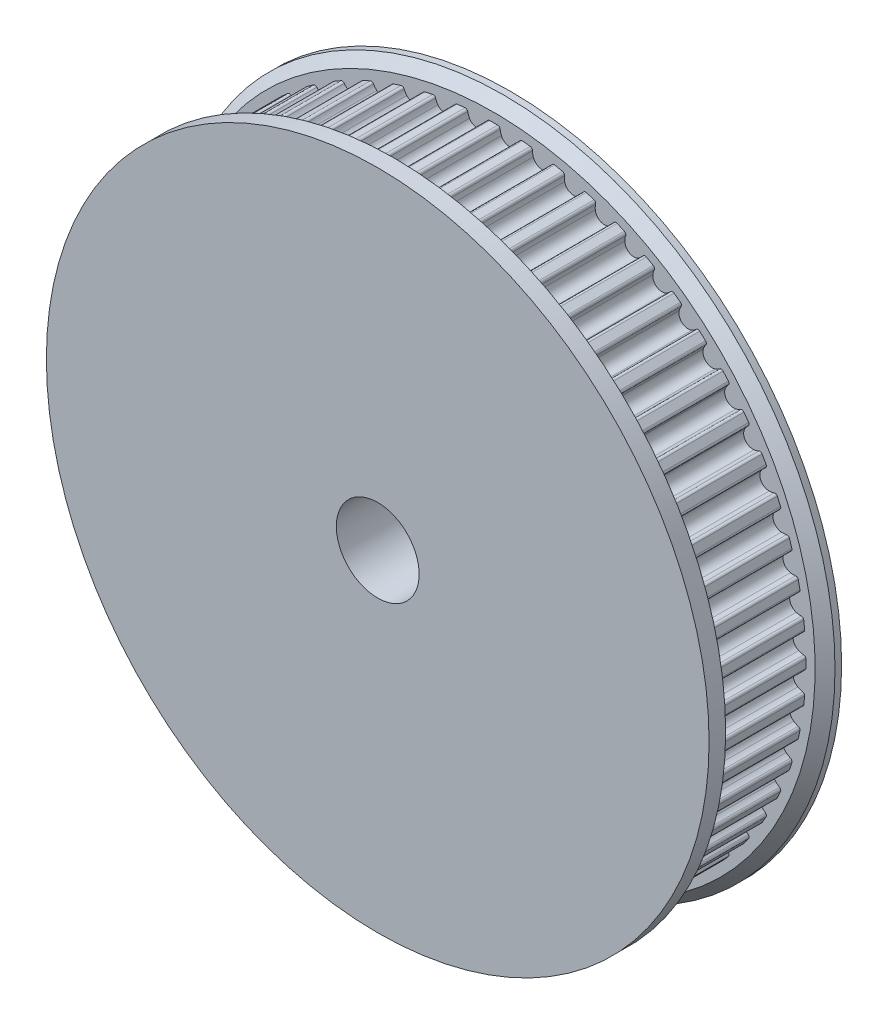
from build123d import *

# Parameters (mm, degrees)
BOSS_EXTRUDE1_DEPTH = 3
SKETCH2_R           = 20
BOSS_EXTRUDE2_DEPTH = 1
BOSS_EXTRUDE3_START = 1
SKETCH3_R           = 20
BOSS_EXTRUDE3_DEPTH = 1
SKETCH7_R           = 10
SKETCH7_R_2         = 6.6
BOSS_EXTRUDE4_DEPTH = 7
SKETCH8_R           = 1.75
CUT_EXTRUDE4_DEPTH  = 31.347981811
CIRPATTERN2_COUNT   = 2
CIRPATTERN2_ANGLE   = 90
SKETCH9_R           = 2.5
CUT_EXTRUDE5_DEPTH  = 30.393876913
FILLET1_R           = 2
FILLET2_R           = 0.8
CHAMFER1_SIZE       = 0.6


with BuildPart() as part:
    # Sketch1 → Boss-Extrude1 (new, symmetric)
    with BuildSketch(Plane.XY):
        with BuildLine():
            Line((0, 18.844593171), (0.2403451, 18.844593171))
            ThreePointArc((0.2403451, 18.844593171), (0.341538212, 18.805317848), (0.389739428, 18.708059226))
            ThreePointArc((0.389739428, 18.708059226), (0.415701801, 18.55472728), (0.465123358, 18.407274778))
            ThreePointArc((0.465123358, 18.407274778), (0.946997836, 18.06979516), (1.461508782, 18.355056431))
            ThreePointArc((1.461508782, 18.355056431), (1.526072586, 18.496535213), (1.567920287, 18.646313384))
            ThreePointArc((1.567920287, 18.646313384), (1.626023746, 18.738000814), (1.730767901, 18.766483422))
            Line((1.730767901, 18.766483422), (1.969796365, 18.741360518))
            Line((1.969796365, 18.741360518), (2.208824829, 18.716237614))
            ThreePointArc((2.208824829, 18.716237614), (2.305358205, 18.666599885), (2.343129077, 18.564835657))
            ThreePointArc((2.343129077, 18.564835657), (2.352921672, 18.409629872), (2.386659509, 18.257819171))
            ThreePointArc((2.386659509, 18.257819171), (2.830618003, 17.871818703), (3.372128326, 18.101736244))
            ThreePointArc((3.372128326, 18.101736244), (3.451127002, 18.235691236), (3.508401539, 18.38027463))
            ThreePointArc((3.508401539, 18.38027463), (3.575770648, 18.465386321), (3.682918246, 18.482764153))
            Line((3.682918246, 18.482764153), (3.918011229, 18.432793597))
            Line((3.918011229, 18.432793597), (4.153104212, 18.382823041))
            ThreePointArc((4.153104212, 18.382823041), (4.243920212, 18.323366747), (4.270846912, 18.218211863))
            ThreePointArc((4.270846912, 18.218211863), (4.264362441, 18.062832707), (4.282046919, 17.908327077))
            ThreePointArc((4.282046919, 17.908327077), (4.683225326, 17.47803486), (5.245802126, 17.650089647))
            ThreePointArc((5.245802126, 17.650089647), (5.338370149, 17.775053209), (5.41044401, 17.912857741))
            ThreePointArc((5.41044401, 17.912857741), (5.486340658, 17.990461192), (5.594717769, 17.996543853))
            Line((5.594717769, 17.996543853), (5.823299542, 17.922273132))
            Line((5.823299542, 17.922273132), (6.051881315, 17.848002412))
            ThreePointArc((6.051881315, 17.848002412), (6.135984941, 17.779378969), (6.151772456, 17.671985528))
            ThreePointArc((6.151772456, 17.671985528), (6.129081962, 17.518135367), (6.130519327, 17.362627603))
            ThreePointArc((6.130519327, 17.362627603), (6.484522253, 16.89275801), (7.06200182, 17.005064975))
            ThreePointArc((7.06200182, 17.005064975), (7.167124995, 17.11966798), (7.253208524, 17.249183834))
            ThreePointArc((7.253208524, 17.249183834), (7.336801172, 17.318428805), (7.445220392, 17.313149652))
            Line((7.445220392, 17.313149652), (7.664786567, 17.215392493))
            Line((7.664786567, 17.215392493), (7.884352741, 17.117635333))
            ThreePointArc((7.884352741, 17.117635333), (7.960822535, 17.040596594), (7.965297893, 16.932141221))
            ThreePointArc((7.965297893, 16.932141221), (7.926649979, 16.781505669), (7.911824483, 16.626699548))
            ThreePointArc((7.911824483, 16.626699548), (8.214773396, 16.122400568), (8.800828745, 16.173729252))
            ThreePointArc((8.800828745, 16.173729252), (8.91735532, 16.276716085), (9.016505367, 16.39652426))
            ThreePointArc((9.016505367, 16.39652426), (9.106878157, 16.456652089), (9.214151623, 16.44006896))
            Line((9.214151623, 16.44006896), (9.422296586, 16.31989641))
            Line((9.422296586, 16.31989641), (9.630441548, 16.19972386))
            ThreePointArc((9.630441548, 16.19972386), (9.698439692, 16.115113877), (9.691553859, 16.006784831))
            ThreePointArc((9.691553859, 16.006784831), (9.63737196, 15.861014284), (9.606446033, 15.708605893))
            ThreePointArc((9.606446033, 15.708605893), (9.855021764, 15.175402731), (10.443231948, 15.165190766))
            ThreePointArc((10.443231948, 15.165190766), (10.569885234, 15.255433084), (10.681015491, 15.364220934))
            ThreePointArc((10.681015491, 15.364220934), (10.777178278, 15.414572848), (10.882130681, 15.386867433))
            Line((10.882130681, 15.386867433), (11.076573951, 15.245596127))
            Line((11.076573951, 15.245596127), (11.271017222, 15.104324822))
            ThreePointArc((11.271017222, 15.104324822), (11.329798713, 15.0130706), (11.311627133, 14.906054758))
            ThreePointArc((11.311627133, 14.906054758), (11.242504877, 14.766746308), (11.195817351, 14.618405465))
            ThreePointArc((11.195817351, 14.618405465), (11.38729645, 14.062140007), (11.971216917, 13.990499277))
            ThreePointArc((11.971216917, 13.990499277), (12.106609273, 14.067008365), (12.228502175, 14.163583989))
            ThreePointArc((12.228502175, 14.163583989), (12.32940138, 14.203608321), (12.430882838, 14.165084166))
            Line((12.430882838, 14.165084166), (12.609494055, 14.004261903))
            Line((12.609494055, 14.004261903), (12.788105272, 13.843439641))
            ThreePointArc((12.788105272, 13.843439641), (12.837026089, 13.74654098), (12.807767853, 13.642010829))
            ThreePointArc((12.807767853, 13.642010829), (12.724462558, 13.510690768), (12.662524951, 13.368042728))
            ThreePointArc((12.662524951, 13.368042728), (12.794809534, 12.794809534), (13.368042728, 12.662524951))
            ThreePointArc((13.368042728, 12.662524951), (13.510690768, 12.724462558), (13.642010829, 12.807767853))
            ThreePointArc((13.642010829, 12.807767853), (13.74654098, 12.837026089), (13.843439641, 12.788105272))
            Line((13.843439641, 12.788105272), (14.004261903, 12.609494055))
            Line((14.004261903, 12.609494055), (14.165084166, 12.430882838))
            ThreePointArc((14.165084166, 12.430882838), (14.203608321, 12.32940138), (14.163583989, 12.228502175))
            ThreePointArc((14.163583989, 12.228502175), (14.067008365, 12.106609273), (13.990499277, 11.971216917))
            ThreePointArc((13.990499277, 11.971216917), (14.062140007, 11.38729645), (14.618405465, 11.195817351))
            ThreePointArc((14.618405465, 11.195817351), (14.766746308, 11.242504877), (14.906054758, 11.311627133))
            ThreePointArc((14.906054758, 11.311627133), (15.0130706, 11.329798713), (15.104324822, 11.271017222))
            Line((15.104324822, 11.271017222), (15.245596127, 11.076573951))
            Line((15.245596127, 11.076573951), (15.386867433, 10.882130681))
            ThreePointArc((15.386867433, 10.882130681), (15.414572848, 10.777178278), (15.364220934, 10.681015491))
            ThreePointArc((15.364220934, 10.681015491), (15.255433084, 10.569885234), (15.165190766, 10.443231948))
            ThreePointArc((15.165190766, 10.443231948), (15.175402731, 9.855021764), (15.708605893, 9.606446033))
            ThreePointArc((15.708605893, 9.606446033), (15.861014284, 9.63737196), (16.006784831, 9.691553859))
            ThreePointArc((16.006784831, 9.691553859), (16.115113877, 9.698439692), (16.19972386, 9.630441548))
            Line((16.19972386, 9.630441548), (16.31989641, 9.422296586))
            Line((16.31989641, 9.422296586), (16.44006896, 9.214151623))
            ThreePointArc((16.44006896, 9.214151623), (16.456652089, 9.106878157), (16.39652426, 9.016505367))
            ThreePointArc((16.39652426, 9.016505367), (16.276716085, 8.91735532), (16.173729252, 8.800828745))
            ThreePointArc((16.173729252, 8.800828745), (16.122400568, 8.214773396), (16.626699548, 7.911824483))
            ThreePointArc((16.626699548, 7.911824483), (16.781505669, 7.926649979), (16.932141221, 7.965297893))
            ThreePointArc((16.932141221, 7.965297893), (17.040596594, 7.960822535), (17.117635333, 7.884352741))
            Line((17.117635333, 7.884352741), (17.215392493, 7.664786567))
            Line((17.215392493, 7.664786567), (17.313149652, 7.445220392))
            ThreePointArc((17.313149652, 7.445220392), (17.318428805, 7.336801172), (17.249183834, 7.253208524))
            ThreePointArc((17.249183834, 7.253208524), (17.11966798, 7.167124995), (17.005064975, 7.06200182))
            ThreePointArc((17.005064975, 7.06200182), (16.89275801, 6.484522253), (17.362627603, 6.130519327))
            ThreePointArc((17.362627603, 6.130519327), (17.518135367, 6.129081962), (17.671985528, 6.151772456))
            ThreePointArc((17.671985528, 6.151772456), (17.779378969, 6.135984941), (17.848002412, 6.051881315))
            Line((17.848002412, 6.051881315), (17.922273132, 5.823299542))
            Line((17.922273132, 5.823299542), (17.996543853, 5.594717769))
            ThreePointArc((17.996543853, 5.594717769), (17.990461192, 5.486340658), (17.912857741, 5.41044401))
            ThreePointArc((17.912857741, 5.41044401), (17.775053209, 5.338370149), (17.650089647, 5.245802126))
            ThreePointArc((17.650089647, 5.245802126), (17.47803486, 4.683225326), (17.908327077, 4.282046919))
            ThreePointArc((17.908327077, 4.282046919), (18.062832707, 4.264362441), (18.218211863, 4.270846912))
            ThreePointArc((18.218211863, 4.270846912), (18.323366747, 4.243920212), (18.382823041, 4.153104212))
            Line((18.382823041, 4.153104212), (18.432793597, 3.918011229))
            Line((18.432793597, 3.918011229), (18.482764153, 3.682918246))
            ThreePointArc((18.482764153, 3.682918246), (18.465386321, 3.575770648), (18.38027463, 3.508401539))
            ThreePointArc((18.38027463, 3.508401539), (18.235691236, 3.451127002), (18.101736244, 3.372128326))
            ThreePointArc((18.101736244, 3.372128326), (17.871818703, 2.830618003), (18.257819171, 2.386659509))
            ThreePointArc((18.257819171, 2.386659509), (18.409629872, 2.352921672), (18.564835657, 2.343129077))
            ThreePointArc((18.564835657, 2.343129077), (18.666599885, 2.305358205), (18.716237614, 2.208824829))
            Line((18.716237614, 2.208824829), (18.741360518, 1.969796365))
            Line((18.741360518, 1.969796365), (18.766483422, 1.730767901))
            ThreePointArc((18.766483422, 1.730767901), (18.738000814, 1.626023746), (18.646313384, 1.567920287))
            ThreePointArc((18.646313384, 1.567920287), (18.496535213, 1.526072586), (18.355056431, 1.461508782))
            ThreePointArc((18.355056431, 1.461508782), (18.06979516, 0.946997836), (18.407274778, 0.465123358))
            ThreePointArc((18.407274778, 0.465123358), (18.55472728, 0.415701801), (18.708059226, 0.389739428))
            ThreePointArc((18.708059226, 0.389739428), (18.805317848, 0.341538212), (18.844593171, 0.2403451))
            Line((18.844593171, 0.2403451), (18.844593171, 0))
            Line((18.844593171, 0), (18.844593171, -0.2403451))
            ThreePointArc((18.844593171, -0.2403451), (18.805317848, -0.341538212), (18.708059226, -0.389739428))
            ThreePointArc((18.708059226, -0.389739428), (18.55472728, -0.415701801), (18.407274778, -0.465123358))
            ThreePointArc((18.407274778, -0.465123358), (18.06979516, -0.946997836), (18.355056431, -1.461508782))
            ThreePointArc((18.355056431, -1.461508782), (18.496535213, -1.526072586), (18.646313384, -1.567920287))
            ThreePointArc((18.646313384, -1.567920287), (18.738000814, -1.626023746), (18.766483422, -1.730767901))
            Line((18.766483422, -1.730767901), (18.741360518, -1.969796365))
            Line((18.741360518, -1.969796365), (18.716237614, -2.208824829))
            ThreePointArc((18.716237614, -2.208824829), (18.666599885, -2.305358205), (18.564835657, -2.343129077))
            ThreePointArc((18.564835657, -2.343129077), (18.409629872, -2.352921672), (18.257819171, -2.386659509))
            ThreePointArc((18.257819171, -2.386659509), (17.871818703, -2.830618003), (18.101736244, -3.372128326))
            ThreePointArc((18.101736244, -3.372128326), (18.235691236, -3.451127002), (18.38027463, -3.508401539))
            ThreePointArc((18.38027463, -3.508401539), (18.465386321, -3.575770648), (18.482764153, -3.682918246))
            Line((18.482764153, -3.682918246), (18.432793597, -3.918011229))
            Line((18.432793597, -3.918011229), (18.382823041, -4.153104212))
            ThreePointArc((18.382823041, -4.153104212), (18.323366747, -4.243920212), (18.218211863, -4.270846912))
            ThreePointArc((18.218211863, -4.270846912), (18.062832707, -4.264362441), (17.908327077, -4.282046919))
            ThreePointArc((17.908327077, -4.282046919), (17.47803486, -4.683225326), (17.650089647, -5.245802126))
            ThreePointArc((17.650089647, -5.245802126), (17.775053209, -5.338370149), (17.912857741, -5.41044401))
            ThreePointArc((17.912857741, -5.41044401), (17.990461192, -5.486340658), (17.996543853, -5.594717769))
            Line((17.996543853, -5.594717769), (17.922273132, -5.823299542))
            Line((17.922273132, -5.823299542), (17.848002412, -6.051881315))
            ThreePointArc((17.848002412, -6.051881315), (17.779378969, -6.135984941), (17.671985528, -6.151772456))
            ThreePointArc((17.671985528, -6.151772456), (17.518135367, -6.129081962), (17.362627603, -6.130519327))
            ThreePointArc((17.362627603, -6.130519327), (16.89275801, -6.484522253), (17.005064975, -7.06200182))
            ThreePointArc((17.005064975, -7.06200182), (17.11966798, -7.167124995), (17.249183834, -7.253208524))
            ThreePointArc((17.249183834, -7.253208524), (17.318428805, -7.336801172), (17.313149652, -7.445220392))
            Line((17.313149652, -7.445220392), (17.215392493, -7.664786567))
            Line((17.215392493, -7.664786567), (17.117635333, -7.884352741))
            ThreePointArc((17.117635333, -7.884352741), (17.040596594, -7.960822535), (16.932141221, -7.965297893))
            ThreePointArc((16.932141221, -7.965297893), (16.781505669, -7.926649979), (16.626699548, -7.911824483))
            ThreePointArc((16.626699548, -7.911824483), (16.122400568, -8.214773396), (16.173729252, -8.800828745))
            ThreePointArc((16.173729252, -8.800828745), (16.276716085, -8.91735532), (16.39652426, -9.016505367))
            ThreePointArc((16.39652426, -9.016505367), (16.456652089, -9.106878157), (16.44006896, -9.214151623))
            Line((16.44006896, -9.214151623), (16.31989641, -9.422296586))
            Line((16.31989641, -9.422296586), (16.19972386, -9.630441548))
            ThreePointArc((16.19972386, -9.630441548), (16.115113877, -9.698439692), (16.006784831, -9.691553859))
            ThreePointArc((16.006784831, -9.691553859), (15.861014284, -9.63737196), (15.708605893, -9.606446033))
            ThreePointArc((15.708605893, -9.606446033), (15.175402731, -9.855021764), (15.165190766, -10.443231948))
            ThreePointArc((15.165190766, -10.443231948), (15.255433084, -10.569885234), (15.364220934, -10.681015491))
            ThreePointArc((15.364220934, -10.681015491), (15.414572848, -10.777178278), (15.386867433, -10.882130681))
            Line((15.386867433, -10.882130681), (15.245596127, -11.076573951))
            Line((15.245596127, -11.076573951), (15.104324822, -11.271017222))
            ThreePointArc((15.104324822, -11.271017222), (15.0130706, -11.329798713), (14.906054758, -11.311627133))
            ThreePointArc((14.906054758, -11.311627133), (14.766746308, -11.242504877), (14.618405465, -11.195817351))
            ThreePointArc((14.618405465, -11.195817351), (14.062140007, -11.38729645), (13.990499277, -11.971216917))
            ThreePointArc((13.990499277, -11.971216917), (14.067008365, -12.106609273), (14.163583989, -12.228502175))
            ThreePointArc((14.163583989, -12.228502175), (14.203608321, -12.32940138), (14.165084166, -12.430882838))
            Line((14.165084166, -12.430882838), (14.004261903, -12.609494055))
            Line((14.004261903, -12.609494055), (13.843439641, -12.788105272))
            ThreePointArc((13.843439641, -12.788105272), (13.74654098, -12.837026089), (13.642010829, -12.807767853))
            ThreePointArc((13.642010829, -12.807767853), (13.510690768, -12.724462558), (13.368042728, -12.662524951))
            ThreePointArc((13.368042728, -12.662524951), (12.794809534, -12.794809534), (12.662524951, -13.368042728))
            ThreePointArc((12.662524951, -13.368042728), (12.724462558, -13.510690768), (12.807767853, -13.642010829))
            ThreePointArc((12.807767853, -13.642010829), (12.837026089, -13.74654098), (12.788105272, -13.843439641))
            Line((12.788105272, -13.843439641), (12.609494055, -14.004261903))
            Line((12.609494055, -14.004261903), (12.430882838, -14.165084166))
            ThreePointArc((12.430882838, -14.165084166), (12.32940138, -14.203608321), (12.228502175, -14.163583989))
            ThreePointArc((12.228502175, -14.163583989), (12.106609273, -14.067008365), (11.971216917, -13.990499277))
            ThreePointArc((11.971216917, -13.990499277), (11.38729645, -14.062140007), (11.195817351, -14.618405465))
            ThreePointArc((11.195817351, -14.618405465), (11.242504877, -14.766746308), (11.311627133, -14.906054758))
            ThreePointArc((11.311627133, -14.906054758), (11.329798713, -15.0130706), (11.271017222, -15.104324822))
            Line((11.271017222, -15.104324822), (11.076573951, -15.245596127))
            Line((11.076573951, -15.245596127), (10.882130681, -15.386867433))
            ThreePointArc((10.882130681, -15.386867433), (10.777178278, -15.414572848), (10.681015491, -15.364220934))
            ThreePointArc((10.681015491, -15.364220934), (10.569885234, -15.255433084), (10.443231948, -15.165190766))
            ThreePointArc((10.443231948, -15.165190766), (9.855021764, -15.175402731), (9.606446033, -15.708605893))
            ThreePointArc((9.606446033, -15.708605893), (9.63737196, -15.861014284), (9.691553859, -16.006784831))
            ThreePointArc((9.691553859, -16.006784831), (9.698439692, -16.115113877), (9.630441548, -16.19972386))
            Line((9.630441548, -16.19972386), (9.422296586, -16.31989641))
            Line((9.422296586, -16.31989641), (9.214151623, -16.44006896))
            ThreePointArc((9.214151623, -16.44006896), (9.106878157, -16.456652089), (9.016505367, -16.39652426))
            ThreePointArc((9.016505367, -16.39652426), (8.91735532, -16.276716085), (8.800828745, -16.173729252))
            ThreePointArc((8.800828745, -16.173729252), (8.214773396, -16.122400568), (7.911824483, -16.626699548))
            ThreePointArc((7.911824483, -16.626699548), (7.926649979, -16.781505669), (7.965297893, -16.932141221))
            ThreePointArc((7.965297893, -16.932141221), (7.960822535, -17.040596594), (7.884352741, -17.117635333))
            Line((7.884352741, -17.117635333), (7.664786567, -17.215392493))
            Line((7.664786567, -17.215392493), (7.445220392, -17.313149652))
            ThreePointArc((7.445220392, -17.313149652), (7.336801172, -17.318428805), (7.253208524, -17.249183834))
            ThreePointArc((7.253208524, -17.249183834), (7.167124995, -17.11966798), (7.06200182, -17.005064975))
            ThreePointArc((7.06200182, -17.005064975), (6.484522253, -16.89275801), (6.130519327, -17.362627603))
            ThreePointArc((6.130519327, -17.362627603), (6.129081962, -17.518135367), (6.151772456, -17.671985528))
            ThreePointArc((6.151772456, -17.671985528), (6.135984941, -17.779378969), (6.051881315, -17.848002412))
            Line((6.051881315, -17.848002412), (5.823299542, -17.922273132))
            Line((5.823299542, -17.922273132), (5.594717769, -17.996543853))
            ThreePointArc((5.594717769, -17.996543853), (5.486340658, -17.990461192), (5.41044401, -17.912857741))
            ThreePointArc((5.41044401, -17.912857741), (5.338370149, -17.775053209), (5.245802126, -17.650089647))
            ThreePointArc((5.245802126, -17.650089647), (4.683225326, -17.47803486), (4.282046919, -17.908327077))
            ThreePointArc((4.282046919, -17.908327077), (4.264362441, -18.062832707), (4.270846912, -18.218211863))
            ThreePointArc((4.270846912, -18.218211863), (4.243920212, -18.323366747), (4.153104212, -18.382823041))
            Line((4.153104212, -18.382823041), (3.918011229, -18.432793597))
            Line((3.918011229, -18.432793597), (3.682918246, -18.482764153))
            ThreePointArc((3.682918246, -18.482764153), (3.575770648, -18.465386321), (3.508401539, -18.38027463))
            ThreePointArc((3.508401539, -18.38027463), (3.451127002, -18.235691236), (3.372128326, -18.101736244))
            ThreePointArc((3.372128326, -18.101736244), (2.830618003, -17.871818703), (2.386659509, -18.257819171))
            ThreePointArc((2.386659509, -18.257819171), (2.352921672, -18.409629872), (2.343129077, -18.564835657))
            ThreePointArc((2.343129077, -18.564835657), (2.305358205, -18.666599885), (2.208824829, -18.716237614))
            Line((2.208824829, -18.716237614), (1.969796365, -18.741360518))
            Line((1.969796365, -18.741360518), (1.730767901, -18.766483422))
            ThreePointArc((1.730767901, -18.766483422), (1.626023746, -18.738000814), (1.567920287, -18.646313384))
            ThreePointArc((1.567920287, -18.646313384), (1.526072586, -18.496535213), (1.461508782, -18.355056431))
            ThreePointArc((1.461508782, -18.355056431), (0.946997836, -18.06979516), (0.465123358, -18.407274778))
            ThreePointArc((0.465123358, -18.407274778), (0.415701801, -18.55472728), (0.389739428, -18.708059226))
            ThreePointArc((0.389739428, -18.708059226), (0.341538212, -18.805317848), (0.2403451, -18.844593171))
            Line((0.2403451, -18.844593171), (0, -18.844593171))
            Line((0, -18.844593171), (-0.2403451, -18.844593171))
            ThreePointArc((-0.2403451, -18.844593171), (-0.341538212, -18.805317848), (-0.389739428, -18.708059226))
            ThreePointArc((-0.389739428, -18.708059226), (-0.415701801, -18.55472728), (-0.465123358, -18.407274778))
            ThreePointArc((-0.465123358, -18.407274778), (-0.946997836, -18.06979516), (-1.461508782, -18.355056431))
            ThreePointArc((-1.461508782, -18.355056431), (-1.526072586, -18.496535213), (-1.567920287, -18.646313384))
            ThreePointArc((-1.567920287, -18.646313384), (-1.626023746, -18.738000814), (-1.730767901, -18.766483422))
            Line((-1.730767901, -18.766483422), (-1.969796365, -18.741360518))
            Line((-1.969796365, -18.741360518), (-2.208824829, -18.716237614))
            ThreePointArc((-2.208824829, -18.716237614), (-2.305358205, -18.666599885), (-2.343129077, -18.564835657))
            ThreePointArc((-2.343129077, -18.564835657), (-2.352921672, -18.409629872), (-2.386659509, -18.257819171))
            ThreePointArc((-2.386659509, -18.257819171), (-2.830618003, -17.871818703), (-3.372128326, -18.101736244))
            ThreePointArc((-3.372128326, -18.101736244), (-3.451127002, -18.235691236), (-3.508401539, -18.38027463))
            ThreePointArc((-3.508401539, -18.38027463), (-3.575770648, -18.465386321), (-3.682918246, -18.482764153))
            Line((-3.682918246, -18.482764153), (-3.918011229, -18.432793597))
            Line((-3.918011229, -18.432793597), (-4.153104212, -18.382823041))
            ThreePointArc((-4.153104212, -18.382823041), (-4.243920212, -18.323366747), (-4.270846912, -18.218211863))
            ThreePointArc((-4.270846912, -18.218211863), (-4.264362441, -18.062832707), (-4.282046919, -17.908327077))
            ThreePointArc((-4.282046919, -17.908327077), (-4.683225326, -17.47803486), (-5.245802126, -17.650089647))
            ThreePointArc((-5.245802126, -17.650089647), (-5.338370149, -17.775053209), (-5.41044401, -17.912857741))
            ThreePointArc((-5.41044401, -17.912857741), (-5.486340658, -17.990461192), (-5.594717769, -17.996543853))
            Line((-5.594717769, -17.996543853), (-5.823299542, -17.922273132))
            Line((-5.823299542, -17.922273132), (-6.051881315, -17.848002412))
            ThreePointArc((-6.051881315, -17.848002412), (-6.135984941, -17.779378969), (-6.151772456, -17.671985528))
            ThreePointArc((-6.151772456, -17.671985528), (-6.129081962, -17.518135367), (-6.130519327, -17.362627603))
            ThreePointArc((-6.130519327, -17.362627603), (-6.484522253, -16.89275801), (-7.06200182, -17.005064975))
            ThreePointArc((-7.06200182, -17.005064975), (-7.167124995, -17.11966798), (-7.253208524, -17.249183834))
            ThreePointArc((-7.253208524, -17.249183834), (-7.336801172, -17.318428805), (-7.445220392, -17.313149652))
            Line((-7.445220392, -17.313149652), (-7.664786567, -17.215392493))
            Line((-7.664786567, -17.215392493), (-7.884352741, -17.117635333))
            ThreePointArc((-7.884352741, -17.117635333), (-7.960822535, -17.040596594), (-7.965297893, -16.932141221))
            ThreePointArc((-7.965297893, -16.932141221), (-7.926649979, -16.781505669), (-7.911824483, -16.626699548))
            ThreePointArc((-7.911824483, -16.626699548), (-8.214773396, -16.122400568), (-8.800828745, -16.173729252))
            ThreePointArc((-8.800828745, -16.173729252), (-8.91735532, -16.276716085), (-9.016505367, -16.39652426))
            ThreePointArc((-9.016505367, -16.39652426), (-9.106878157, -16.456652089), (-9.214151623, -16.44006896))
            Line((-9.214151623, -16.44006896), (-9.422296586, -16.31989641))
            Line((-9.422296586, -16.31989641), (-9.630441548, -16.19972386))
            ThreePointArc((-9.630441548, -16.19972386), (-9.698439692, -16.115113877), (-9.691553859, -16.006784831))
            ThreePointArc((-9.691553859, -16.006784831), (-9.63737196, -15.861014284), (-9.606446033, -15.708605893))
            ThreePointArc((-9.606446033, -15.708605893), (-9.855021764, -15.175402731), (-10.443231948, -15.165190766))
            ThreePointArc((-10.443231948, -15.165190766), (-10.569885234, -15.255433084), (-10.681015491, -15.364220934))
            ThreePointArc((-10.681015491, -15.364220934), (-10.777178278, -15.414572848), (-10.882130681, -15.386867433))
            Line((-10.882130681, -15.386867433), (-11.076573951, -15.245596127))
            Line((-11.076573951, -15.245596127), (-11.271017222, -15.104324822))
            ThreePointArc((-11.271017222, -15.104324822), (-11.329798713, -15.0130706), (-11.311627133, -14.906054758))
            ThreePointArc((-11.311627133, -14.906054758), (-11.242504877, -14.766746308), (-11.195817351, -14.618405465))
            ThreePointArc((-11.195817351, -14.618405465), (-11.38729645, -14.062140007), (-11.971216917, -13.990499277))
            ThreePointArc((-11.971216917, -13.990499277), (-12.106609273, -14.067008365), (-12.228502175, -14.163583989))
            ThreePointArc((-12.228502175, -14.163583989), (-12.32940138, -14.203608321), (-12.430882838, -14.165084166))
            Line((-12.430882838, -14.165084166), (-12.609494055, -14.004261903))
            Line((-12.609494055, -14.004261903), (-12.788105272, -13.843439641))
            ThreePointArc((-12.788105272, -13.843439641), (-12.837026089, -13.74654098), (-12.807767853, -13.642010829))
            ThreePointArc((-12.807767853, -13.642010829), (-12.724462558, -13.510690768), (-12.662524951, -13.368042728))
            ThreePointArc((-12.662524951, -13.368042728), (-12.794809534, -12.794809534), (-13.368042728, -12.662524951))
            ThreePointArc((-13.368042728, -12.662524951), (-13.510690768, -12.724462558), (-13.642010829, -12.807767853))
            ThreePointArc((-13.642010829, -12.807767853), (-13.74654098, -12.837026089), (-13.843439641, -12.788105272))
            Line((-13.843439641, -12.788105272), (-14.004261903, -12.609494055))
            Line((-14.004261903, -12.609494055), (-14.165084166, -12.430882838))
            ThreePointArc((-14.165084166, -12.430882838), (-14.203608321, -12.32940138), (-14.163583989, -12.228502175))
            ThreePointArc((-14.163583989, -12.228502175), (-14.067008365, -12.106609273), (-13.990499277, -11.971216917))
            ThreePointArc((-13.990499277, -11.971216917), (-14.062140007, -11.38729645), (-14.618405465, -11.195817351))
            ThreePointArc((-14.618405465, -11.195817351), (-14.766746308, -11.242504877), (-14.906054758, -11.311627133))
            ThreePointArc((-14.906054758, -11.311627133), (-15.0130706, -11.329798713), (-15.104324822, -11.271017222))
            Line((-15.104324822, -11.271017222), (-15.245596127, -11.076573951))
            Line((-15.245596127, -11.076573951), (-15.386867433, -10.882130681))
            ThreePointArc((-15.386867433, -10.882130681), (-15.414572848, -10.777178278), (-15.364220934, -10.681015491))
            ThreePointArc((-15.364220934, -10.681015491), (-15.255433084, -10.569885234), (-15.165190766, -10.443231948))
            ThreePointArc((-15.165190766, -10.443231948), (-15.175402731, -9.855021764), (-15.708605893, -9.606446033))
            ThreePointArc((-15.708605893, -9.606446033), (-15.861014284, -9.63737196), (-16.006784831, -9.691553859))
            ThreePointArc((-16.006784831, -9.691553859), (-16.115113877, -9.698439692), (-16.19972386, -9.630441548))
            Line((-16.19972386, -9.630441548), (-16.31989641, -9.422296586))
            Line((-16.31989641, -9.422296586), (-16.44006896, -9.214151623))
            ThreePointArc((-16.44006896, -9.214151623), (-16.456652089, -9.106878157), (-16.39652426, -9.016505367))
            ThreePointArc((-16.39652426, -9.016505367), (-16.276716085, -8.91735532), (-16.173729252, -8.800828745))
            ThreePointArc((-16.173729252, -8.800828745), (-16.122400568, -8.214773396), (-16.626699548, -7.911824483))
            ThreePointArc((-16.626699548, -7.911824483), (-16.781505669, -7.926649979), (-16.932141221, -7.965297893))
            ThreePointArc((-16.932141221, -7.965297893), (-17.040596594, -7.960822535), (-17.117635333, -7.884352741))
            Line((-17.117635333, -7.884352741), (-17.215392493, -7.664786567))
            Line((-17.215392493, -7.664786567), (-17.313149652, -7.445220392))
            ThreePointArc((-17.313149652, -7.445220392), (-17.318428805, -7.336801172), (-17.249183834, -7.253208524))
            ThreePointArc((-17.249183834, -7.253208524), (-17.11966798, -7.167124995), (-17.005064975, -7.06200182))
            ThreePointArc((-17.005064975, -7.06200182), (-16.89275801, -6.484522253), (-17.362627603, -6.130519327))
            ThreePointArc((-17.362627603, -6.130519327), (-17.518135367, -6.129081962), (-17.671985528, -6.151772456))
            ThreePointArc((-17.671985528, -6.151772456), (-17.779378969, -6.135984941), (-17.848002412, -6.051881315))
            Line((-17.848002412, -6.051881315), (-17.922273132, -5.823299542))
            Line((-17.922273132, -5.823299542), (-17.996543853, -5.594717769))
            ThreePointArc((-17.996543853, -5.594717769), (-17.990461192, -5.486340658), (-17.912857741, -5.41044401))
            ThreePointArc((-17.912857741, -5.41044401), (-17.775053209, -5.338370149), (-17.650089647, -5.245802126))
            ThreePointArc((-17.650089647, -5.245802126), (-17.47803486, -4.683225326), (-17.908327077, -4.282046919))
            ThreePointArc((-17.908327077, -4.282046919), (-18.062832707, -4.264362441), (-18.218211863, -4.270846912))
            ThreePointArc((-18.218211863, -4.270846912), (-18.323366747, -4.243920212), (-18.382823041, -4.153104212))
            Line((-18.382823041, -4.153104212), (-18.432793597, -3.918011229))
            Line((-18.432793597, -3.918011229), (-18.482764153, -3.682918246))
            ThreePointArc((-18.482764153, -3.682918246), (-18.465386321, -3.575770648), (-18.38027463, -3.508401539))
            ThreePointArc((-18.38027463, -3.508401539), (-18.235691236, -3.451127002), (-18.101736244, -3.372128326))
            ThreePointArc((-18.101736244, -3.372128326), (-17.871818703, -2.830618003), (-18.257819171, -2.386659509))
            ThreePointArc((-18.257819171, -2.386659509), (-18.409629872, -2.352921672), (-18.564835657, -2.343129077))
            ThreePointArc((-18.564835657, -2.343129077), (-18.666599885, -2.305358205), (-18.716237614, -2.208824829))
            Line((-18.716237614, -2.208824829), (-18.741360518, -1.969796365))
            Line((-18.741360518, -1.969796365), (-18.766483422, -1.730767901))
            ThreePointArc((-18.766483422, -1.730767901), (-18.738000814, -1.626023746), (-18.646313384, -1.567920287))
            ThreePointArc((-18.646313384, -1.567920287), (-18.496535213, -1.526072586), (-18.355056431, -1.461508782))
            ThreePointArc((-18.355056431, -1.461508782), (-18.06979516, -0.946997836), (-18.407274778, -0.465123358))
            ThreePointArc((-18.407274778, -0.465123358), (-18.55472728, -0.415701801), (-18.708059226, -0.389739428))
            ThreePointArc((-18.708059226, -0.389739428), (-18.805317848, -0.341538212), (-18.844593171, -0.2403451))
            Line((-18.844593171, -0.2403451), (-18.844593171, 0))
            Line((-18.844593171, 0), (-18.844593171, 0.2403451))
            ThreePointArc((-18.844593171, 0.2403451), (-18.805317848, 0.341538212), (-18.708059226, 0.389739428))
            ThreePointArc((-18.708059226, 0.389739428), (-18.55472728, 0.415701801), (-18.407274778, 0.465123358))
            ThreePointArc((-18.407274778, 0.465123358), (-18.06979516, 0.946997836), (-18.355056431, 1.461508782))
            ThreePointArc((-18.355056431, 1.461508782), (-18.496535213, 1.526072586), (-18.646313384, 1.567920287))
            ThreePointArc((-18.646313384, 1.567920287), (-18.738000814, 1.626023746), (-18.766483422, 1.730767901))
            Line((-18.766483422, 1.730767901), (-18.741360518, 1.969796365))
            Line((-18.741360518, 1.969796365), (-18.716237614, 2.208824829))
            ThreePointArc((-18.716237614, 2.208824829), (-18.666599885, 2.305358205), (-18.564835657, 2.343129077))
            ThreePointArc((-18.564835657, 2.343129077), (-18.409629872, 2.352921672), (-18.257819171, 2.386659509))
            ThreePointArc((-18.257819171, 2.386659509), (-17.871818703, 2.830618003), (-18.101736244, 3.372128326))
            ThreePointArc((-18.101736244, 3.372128326), (-18.235691236, 3.451127002), (-18.38027463, 3.508401539))
            ThreePointArc((-18.38027463, 3.508401539), (-18.465386321, 3.575770648), (-18.482764153, 3.682918246))
            Line((-18.482764153, 3.682918246), (-18.432793597, 3.918011229))
            Line((-18.432793597, 3.918011229), (-18.382823041, 4.153104212))
            ThreePointArc((-18.382823041, 4.153104212), (-18.323366747, 4.243920212), (-18.218211863, 4.270846912))
            ThreePointArc((-18.218211863, 4.270846912), (-18.062832707, 4.264362441), (-17.908327077, 4.282046919))
            ThreePointArc((-17.908327077, 4.282046919), (-17.47803486, 4.683225326), (-17.650089647, 5.245802126))
            ThreePointArc((-17.650089647, 5.245802126), (-17.775053209, 5.338370149), (-17.912857741, 5.41044401))
            ThreePointArc((-17.912857741, 5.41044401), (-17.990461192, 5.486340658), (-17.996543853, 5.594717769))
            Line((-17.996543853, 5.594717769), (-17.922273132, 5.823299542))
            Line((-17.922273132, 5.823299542), (-17.848002412, 6.051881315))
            ThreePointArc((-17.848002412, 6.051881315), (-17.779378969, 6.135984941), (-17.671985528, 6.151772456))
            ThreePointArc((-17.671985528, 6.151772456), (-17.518135367, 6.129081962), (-17.362627603, 6.130519327))
            ThreePointArc((-17.362627603, 6.130519327), (-16.89275801, 6.484522253), (-17.005064975, 7.06200182))
            ThreePointArc((-17.005064975, 7.06200182), (-17.11966798, 7.167124995), (-17.249183834, 7.253208524))
            ThreePointArc((-17.249183834, 7.253208524), (-17.318428805, 7.336801172), (-17.313149652, 7.445220392))
            Line((-17.313149652, 7.445220392), (-17.215392493, 7.664786567))
            Line((-17.215392493, 7.664786567), (-17.117635333, 7.884352741))
            ThreePointArc((-17.117635333, 7.884352741), (-17.040596594, 7.960822535), (-16.932141221, 7.965297893))
            ThreePointArc((-16.932141221, 7.965297893), (-16.781505669, 7.926649979), (-16.626699548, 7.911824483))
            ThreePointArc((-16.626699548, 7.911824483), (-16.122400568, 8.214773396), (-16.173729252, 8.800828745))
            ThreePointArc((-16.173729252, 8.800828745), (-16.276716085, 8.91735532), (-16.39652426, 9.016505367))
            ThreePointArc((-16.39652426, 9.016505367), (-16.456652089, 9.106878157), (-16.44006896, 9.214151623))
            Line((-16.44006896, 9.214151623), (-16.31989641, 9.422296586))
            Line((-16.31989641, 9.422296586), (-16.19972386, 9.630441548))
            ThreePointArc((-16.19972386, 9.630441548), (-16.115113877, 9.698439692), (-16.006784831, 9.691553859))
            ThreePointArc((-16.006784831, 9.691553859), (-15.861014284, 9.63737196), (-15.708605893, 9.606446033))
            ThreePointArc((-15.708605893, 9.606446033), (-15.175402731, 9.855021764), (-15.165190766, 10.443231948))
            ThreePointArc((-15.165190766, 10.443231948), (-15.255433084, 10.569885234), (-15.364220934, 10.681015491))
            ThreePointArc((-15.364220934, 10.681015491), (-15.414572848, 10.777178278), (-15.386867433, 10.882130681))
            Line((-15.386867433, 10.882130681), (-15.245596127, 11.076573951))
            Line((-15.245596127, 11.076573951), (-15.104324822, 11.271017222))
            ThreePointArc((-15.104324822, 11.271017222), (-15.0130706, 11.329798713), (-14.906054758, 11.311627133))
            ThreePointArc((-14.906054758, 11.311627133), (-14.766746308, 11.242504877), (-14.618405465, 11.195817351))
            ThreePointArc((-14.618405465, 11.195817351), (-14.062140007, 11.38729645), (-13.990499277, 11.971216917))
            ThreePointArc((-13.990499277, 11.971216917), (-14.067008365, 12.106609273), (-14.163583989, 12.228502175))
            ThreePointArc((-14.163583989, 12.228502175), (-14.203608321, 12.32940138), (-14.165084166, 12.430882838))
            Line((-14.165084166, 12.430882838), (-14.004261903, 12.609494055))
            Line((-14.004261903, 12.609494055), (-13.843439641, 12.788105272))
            ThreePointArc((-13.843439641, 12.788105272), (-13.74654098, 12.837026089), (-13.642010829, 12.807767853))
            ThreePointArc((-13.642010829, 12.807767853), (-13.510690768, 12.724462558), (-13.368042728, 12.662524951))
            ThreePointArc((-13.368042728, 12.662524951), (-12.794809534, 12.794809534), (-12.662524951, 13.368042728))
            ThreePointArc((-12.662524951, 13.368042728), (-12.724462558, 13.510690768), (-12.807767853, 13.642010829))
            ThreePointArc((-12.807767853, 13.642010829), (-12.837026089, 13.74654098), (-12.788105272, 13.843439641))
            Line((-12.788105272, 13.843439641), (-12.609494055, 14.004261903))
            Line((-12.609494055, 14.004261903), (-12.430882838, 14.165084166))
            ThreePointArc((-12.430882838, 14.165084166), (-12.32940138, 14.203608321), (-12.228502175, 14.163583989))
            ThreePointArc((-12.228502175, 14.163583989), (-12.106609273, 14.067008365), (-11.971216917, 13.990499277))
            ThreePointArc((-11.971216917, 13.990499277), (-11.38729645, 14.062140007), (-11.195817351, 14.618405465))
            ThreePointArc((-11.195817351, 14.618405465), (-11.242504877, 14.766746308), (-11.311627133, 14.906054758))
            ThreePointArc((-11.311627133, 14.906054758), (-11.329798713, 15.0130706), (-11.271017222, 15.104324822))
            Line((-11.271017222, 15.104324822), (-11.076573951, 15.245596127))
            Line((-11.076573951, 15.245596127), (-10.882130681, 15.386867433))
            ThreePointArc((-10.882130681, 15.386867433), (-10.777178278, 15.414572848), (-10.681015491, 15.364220934))
            ThreePointArc((-10.681015491, 15.364220934), (-10.569885234, 15.255433084), (-10.443231948, 15.165190766))
            ThreePointArc((-10.443231948, 15.165190766), (-9.855021764, 15.175402731), (-9.606446033, 15.708605893))
            ThreePointArc((-9.606446033, 15.708605893), (-9.63737196, 15.861014284), (-9.691553859, 16.006784831))
            ThreePointArc((-9.691553859, 16.006784831), (-9.698439692, 16.115113877), (-9.630441548, 16.19972386))
            Line((-9.630441548, 16.19972386), (-9.422296586, 16.31989641))
            Line((-9.422296586, 16.31989641), (-9.214151623, 16.44006896))
            ThreePointArc((-9.214151623, 16.44006896), (-9.106878157, 16.456652089), (-9.016505367, 16.39652426))
            ThreePointArc((-9.016505367, 16.39652426), (-8.91735532, 16.276716085), (-8.800828745, 16.173729252))
            ThreePointArc((-8.800828745, 16.173729252), (-8.214773396, 16.122400568), (-7.911824483, 16.626699548))
            ThreePointArc((-7.911824483, 16.626699548), (-7.926649979, 16.781505669), (-7.965297893, 16.932141221))
            ThreePointArc((-7.965297893, 16.932141221), (-7.960822535, 17.040596594), (-7.884352741, 17.117635333))
            Line((-7.884352741, 17.117635333), (-7.664786567, 17.215392493))
            Line((-7.664786567, 17.215392493), (-7.445220392, 17.313149652))
            ThreePointArc((-7.445220392, 17.313149652), (-7.336801172, 17.318428805), (-7.253208524, 17.249183834))
            ThreePointArc((-7.253208524, 17.249183834), (-7.167124995, 17.11966798), (-7.06200182, 17.005064975))
            ThreePointArc((-7.06200182, 17.005064975), (-6.484522253, 16.89275801), (-6.130519327, 17.362627603))
            ThreePointArc((-6.130519327, 17.362627603), (-6.129081962, 17.518135367), (-6.151772456, 17.671985528))
            ThreePointArc((-6.151772456, 17.671985528), (-6.135984941, 17.779378969), (-6.051881315, 17.848002412))
            Line((-6.051881315, 17.848002412), (-5.823299542, 17.922273132))
            Line((-5.823299542, 17.922273132), (-5.594717769, 17.996543853))
            ThreePointArc((-5.594717769, 17.996543853), (-5.486340658, 17.990461192), (-5.41044401, 17.912857741))
            ThreePointArc((-5.41044401, 17.912857741), (-5.338370149, 17.775053209), (-5.245802126, 17.650089647))
            ThreePointArc((-5.245802126, 17.650089647), (-4.683225326, 17.47803486), (-4.282046919, 17.908327077))
            ThreePointArc((-4.282046919, 17.908327077), (-4.264362441, 18.062832707), (-4.270846912, 18.218211863))
            ThreePointArc((-4.270846912, 18.218211863), (-4.243920212, 18.323366747), (-4.153104212, 18.382823041))
            Line((-4.153104212, 18.382823041), (-3.918011229, 18.432793597))
            Line((-3.918011229, 18.432793597), (-3.682918246, 18.482764153))
            ThreePointArc((-3.682918246, 18.482764153), (-3.575770648, 18.465386321), (-3.508401539, 18.38027463))
            ThreePointArc((-3.508401539, 18.38027463), (-3.451127002, 18.235691236), (-3.372128326, 18.101736244))
            ThreePointArc((-3.372128326, 18.101736244), (-2.830618003, 17.871818703), (-2.386659509, 18.257819171))
            ThreePointArc((-2.386659509, 18.257819171), (-2.352921672, 18.409629872), (-2.343129077, 18.564835657))
            ThreePointArc((-2.343129077, 18.564835657), (-2.305358205, 18.666599885), (-2.208824829, 18.716237614))
            Line((-2.208824829, 18.716237614), (-1.969796365, 18.741360518))
            Line((-1.969796365, 18.741360518), (-1.730767901, 18.766483422))
            ThreePointArc((-1.730767901, 18.766483422), (-1.626023746, 18.738000814), (-1.567920287, 18.646313384))
            ThreePointArc((-1.567920287, 18.646313384), (-1.526072586, 18.496535213), (-1.461508782, 18.355056431))
            ThreePointArc((-1.461508782, 18.355056431), (-0.946997836, 18.06979516), (-0.465123358, 18.407274778))
            ThreePointArc((-0.465123358, 18.407274778), (-0.415701801, 18.55472728), (-0.389739428, 18.708059226))
            ThreePointArc((-0.389739428, 18.708059226), (-0.341538212, 18.805317848), (-0.2403451, 18.844593171))
            Line((-0.2403451, 18.844593171), (0, 18.844593171))
        make_face()
    extrude(amount=BOSS_EXTRUDE1_DEPTH, both=True)

    # Sketch2 → Boss-Extrude2 (add)
    with BuildSketch(Plane(origin=(0, 0, -3), x_dir=(-1, 0, 0), z_dir=(0, 0, -1))):
        Circle(SKETCH2_R)
    extrude(amount=BOSS_EXTRUDE2_DEPTH)

    # Sketch3 → Boss-Extrude3 (add)
    with BuildSketch(Plane.XY.offset(3).offset(BOSS_EXTRUDE3_START)):
        Circle(SKETCH3_R)
    extrude(amount=-BOSS_EXTRUDE3_DEPTH)

    # Sketch7 → Boss-Extrude4 (add)
    with BuildSketch(Plane(origin=(0, 0, -4), x_dir=(-1, 0, 0), z_dir=(0, 0, -1))):
        Circle(SKETCH7_R)
        Circle(SKETCH7_R_2, mode=Mode.SUBTRACT)
    extrude(amount=BOSS_EXTRUDE4_DEPTH)

    # Sketch8 → Cut-Extrude4 (cut, through all)
    with BuildSketch(Plane(origin=(0, 0, 0), x_dir=(1, 0, 0), z_dir=(0, 1, 0))):
        with Locations((0, 8)):
            Circle(SKETCH8_R)
    cut_extrude4 = extrude(amount=-CUT_EXTRUDE4_DEPTH, mode=Mode.SUBTRACT)

    # CirPattern2: Cut-Extrude4 ×2 about axis
    cirpattern2_axis = Axis((0, 0, -11), (0, 0, 1))
    for i in range(1, CIRPATTERN2_COUNT):
        add(cut_extrude4.rotate(cirpattern2_axis, i * CIRPATTERN2_ANGLE / (CIRPATTERN2_COUNT - 1)), mode=Mode.SUBTRACT)

    # Sketch9 → Cut-Extrude5 (cut, through all)
    with BuildSketch(Plane(origin=(0, 0, -4), x_dir=(-1, 0, 0), z_dir=(0, 0, -1))):
        Circle(SKETCH9_R)
    extrude(amount=-CUT_EXTRUDE5_DEPTH, mode=Mode.SUBTRACT)

    # Fillet1
    fillet1_edges = [part.edges().sort_by_distance(p)[0] for p in [
        (10, 0, -4),
    ]]
    fillet(fillet1_edges, radius=FILLET1_R)

    # Fillet2
    fillet2_edges = [part.edges().sort_by_distance(p)[0] for p in [
        (10, 0, -11),
    ]]
    fillet(fillet2_edges, radius=FILLET2_R)

    # Chamfer1
    chamfer1_edges = [part.edges().sort_by_distance(p)[0] for p in [
        (20, 0, -3),
    ]]
    chamfer(chamfer1_edges, length=CHAMFER1_SIZE)


solid = part.part
